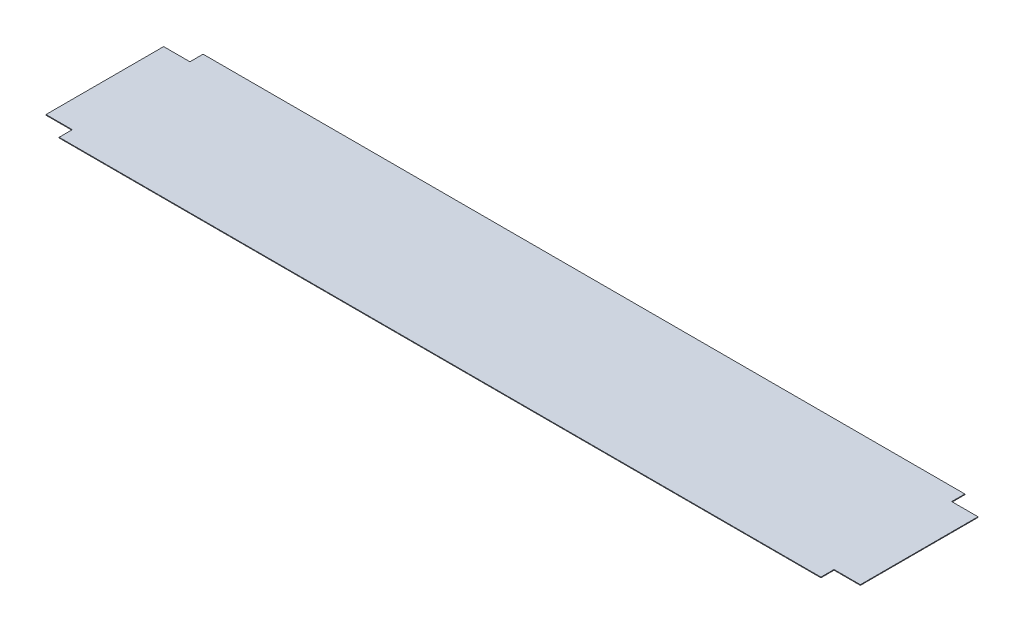
from build123d import *

# Parameters (mm, degrees)
BASE_FLANGE1_DEPTH = 1


# Sheet-metal steps are written as plain solids
with BuildPart() as part:
    # Sketch1 → Base-Flange1 (new body)
    with BuildSketch(Plane(origin=(0, 0, 0), x_dir=(1, 0, 0), z_dir=(0, 1, 0))):
        Polygon((579.5, 109.5), (579.5, 89.5), (619.5, 89.5), (619.5, -89.5), (579.5, -89.5), (579.5, -109.5), (-579.5, -109.5), (-579.5, -89.5), (-619.5, -89.5), (-619.5, 89.5), (-579.5, 89.5), (-579.5, 109.5), align=None)
    extrude(amount=-BASE_FLANGE1_DEPTH)


solid = part.part
